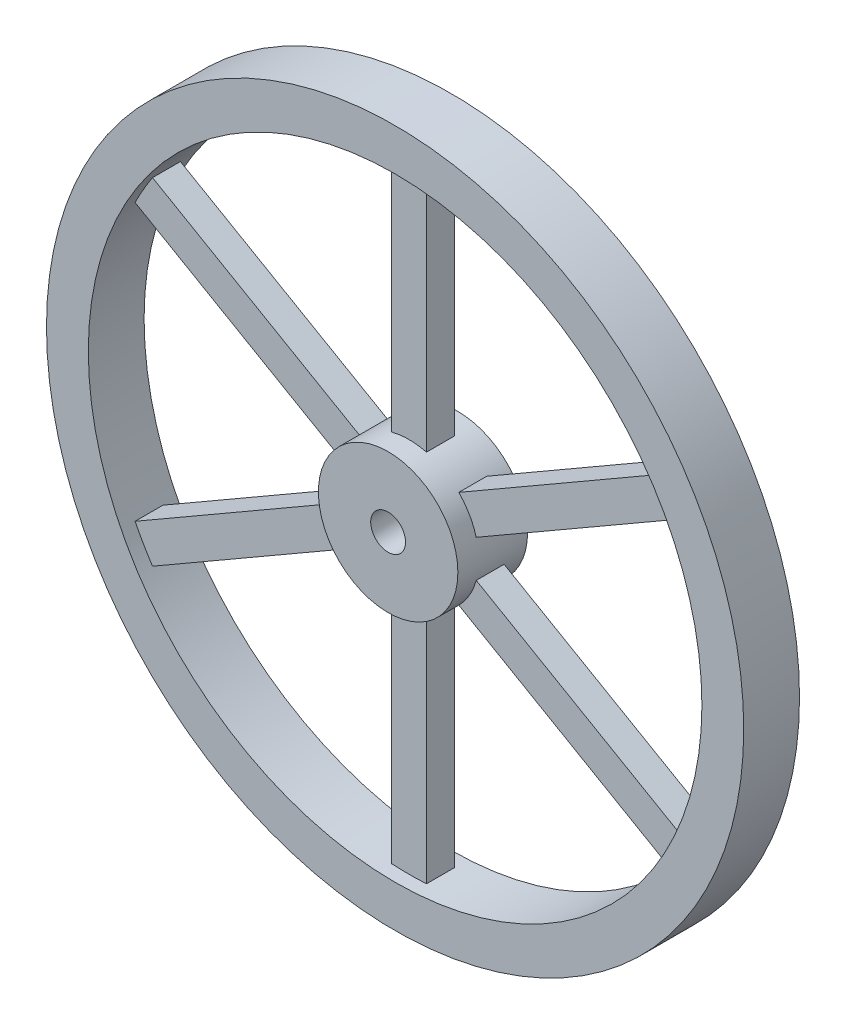
from build123d import *

# Parameters (mm, degrees)
SKETCH1_R           = 50
SKETCH1_R_2         = 44
BOSS_EXTRUDE1_DEPTH = 4
SKETCH2_R           = 10
BOSS_EXTRUDE2_DEPTH = 5
SKETCH3_W           = 5
SKETCH3_H           = 36
BOSS_EXTRUDE3_DEPTH = 2
SKETCH4_R           = 2.5
CUT_EXTRUDE1_DEPTH  = 6
CIRPATTERN1_COUNT   = 6


with BuildPart() as part:
    # Sketch1 → Boss-Extrude1 (new, symmetric)
    with BuildSketch(Plane.XY):
        Circle(SKETCH1_R)
        Circle(SKETCH1_R_2, mode=Mode.SUBTRACT)
    extrude(amount=BOSS_EXTRUDE1_DEPTH, both=True)



with BuildPart() as body_2:
    # Sketch2 → Boss-Extrude2 (new, symmetric)
    with BuildSketch(Plane.XY):
        Circle(SKETCH2_R)
    extrude(amount=BOSS_EXTRUDE2_DEPTH, both=True)


with BuildPart() as part_1:
    add(part.part)

    add(body_2.part)  # Boss-Extrude3 merges body 2
    # Sketch3 → Boss-Extrude3 (add, symmetric)
    with BuildSketch(Plane.XY):
        with Locations((0, 27)):
            Rectangle(SKETCH3_W, SKETCH3_H)
    boss_extrude3 = extrude(amount=BOSS_EXTRUDE3_DEPTH, both=True)

    # Sketch4 → Cut-Extrude1 (cut, symmetric)
    with BuildSketch(Plane.XY):
        Circle(SKETCH4_R)
    extrude(amount=CUT_EXTRUDE1_DEPTH, both=True, mode=Mode.SUBTRACT)

    # CirPattern1: Boss-Extrude3 ×6 about axis
    cirpattern1_axis = Axis((0, 0, 5), (0, 0, 1))
    for i in range(1, CIRPATTERN1_COUNT):
        add(boss_extrude3.rotate(cirpattern1_axis, i * 360 / CIRPATTERN1_COUNT))


solid = part_1.part
